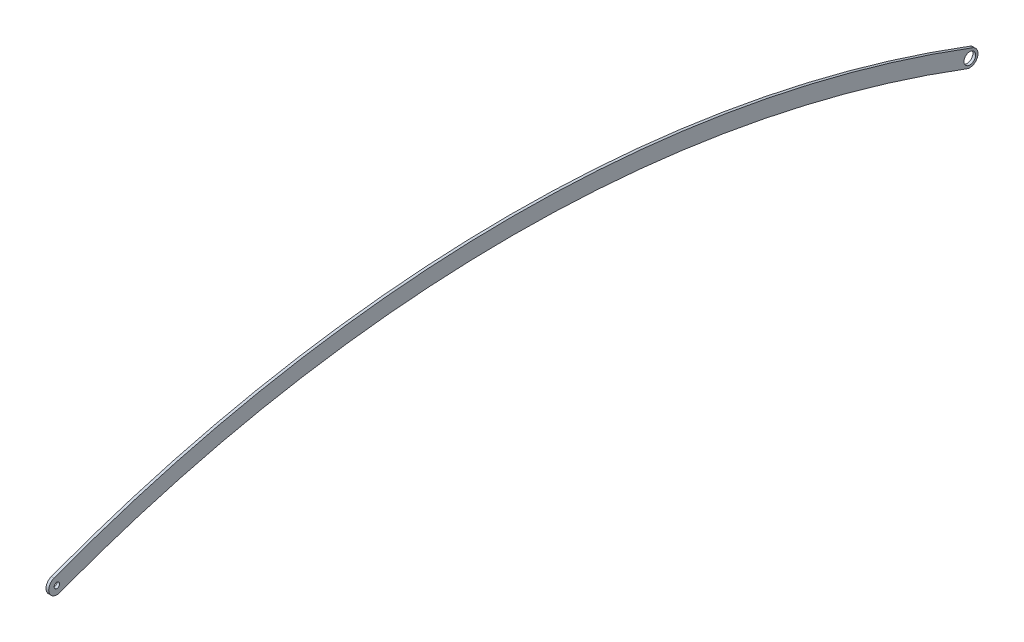
from build123d import *

# Parameters (mm, degrees)
SKETCH1_R           = 1.6
SKETCH1_R_2         = 3.3782
BOSS_EXTRUDE1_DEPTH = 1.5875


with BuildPart() as part:
    # Sketch1 → Boss-Extrude1 (new body)
    with BuildSketch(Plane(origin=(0, 0, 0), x_dir=(0, 0, -1), z_dir=(1, 0, 0))):
        with BuildLine():
            ThreePointArc((-1.684579767, 4.454615276), (-4.454615276, -1.684579767), (1.684579767, -4.454615276))
            ThreePointArc((1.684579767, -4.454615276), (265.04055, 43.678029881), (528.396520233, -4.454615276))
            ThreePointArc((528.396520233, -4.454615276), (534.535715276, -1.684579767), (531.765679767, 4.454615276))
            ThreePointArc((531.765679767, 4.454615276), (265.04055, 53.203029881), (-1.684579767, 4.454615276))
        make_face()
        Circle(SKETCH1_R, mode=Mode.SUBTRACT)
        with Locations((530.0811, 0)):
            Circle(SKETCH1_R_2, mode=Mode.SUBTRACT)
    extrude(amount=BOSS_EXTRUDE1_DEPTH)


solid = part.part
